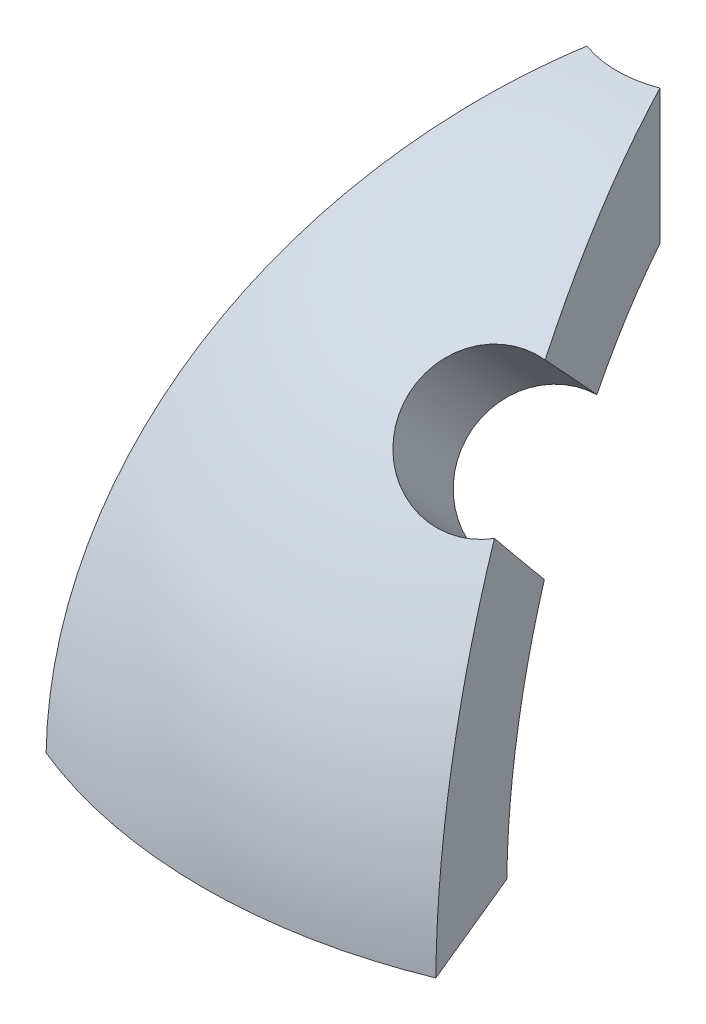
from build123d import *

# Parameters (mm, degrees)
REVOLVE1_ANGLE            = 45
CUT_EXTRUDE1_DEPTH        = 28.647117169
CUT_EXTRUDE1_DEPTH_BACK   = 28.647117169
CUT_EXTRUDE4_REACH        = 29.998
CUT_EXTRUDE4_START_RADIUS = 14.22
CUT_EXTRUDE4_END_RADIUS   = 14.22
CUT_EXTRUDE5_DEPTH        = 27.866361913
CUT_EXTRUDE5_DEPTH_BACK   = 27.866361913
SKETCH9_R                 = 2.6035


with BuildPart() as part:
    # Sketch1 → Revolve1 (revolve, symmetric)
    with BuildSketch(Plane(origin=(0, 0, 0), x_dir=(0, 0, -1), z_dir=(1, 0, 0))) as revolve1_sk:
        with BuildLine():
            Line((-14.217802221, 0.25), (-19.048359509, 0.25))
            ThreePointArc((-19.048359509, 0.25), (-14.676690222, 12.144845166), (-3.81, 18.66511184))
            Line((-3.81, 18.66511184), (-3.81, 13.700083941))
            ThreePointArc((-3.81, 13.700083941), (-11.246181696, 8.70240181), (-14.217802221, 0.25))
        make_face()
    revolve(axis=Axis((0, 0, 0), (0, 1, 0)), revolution_arc=REVOLVE1_ANGLE / 2)
    revolve(revolve1_sk.sketch, axis=Axis((0, 0, 0), (0, -1, 0)), revolution_arc=REVOLVE1_ANGLE / 2)

    # Sketch2 → Cut-Extrude1 (cut, two sides: drawn at the far end of the back side and taken through both)
    with BuildSketch(Plane(origin=(0, 0, 0), x_dir=(1, 0, 0), z_dir=(0, 1, 0)).offset(-CUT_EXTRUDE1_DEPTH_BACK)):
        with BuildLine():
            Line((7.289491598, -17.598389479), (1.458023877, -3.519981019))
            ThreePointArc((1.458023877, -3.519981019), (1.400077392, -3.543428184), (1.341754023, -3.5659215))
            Line((1.341754023, -3.5659215), (7.173849701, -17.645845983))
            ThreePointArc((7.173849701, -17.645845983), (7.231709577, -17.622212591), (7.289491598, -17.598389479))
        make_face()
        with BuildLine():
            Line((-7.173849701, -17.645845983), (-1.341754023, -3.5659215))
            ThreePointArc((-1.341754023, -3.5659215), (-1.400077392, -3.543428184), (-1.458023877, -3.519981019))
            Line((-1.458023877, -3.519981019), (-7.289491598, -17.598389479))
            ThreePointArc((-7.289491598, -17.598389479), (-7.231709577, -17.622212591), (-7.173849701, -17.645845983))
        make_face()
    extrude(amount=CUT_EXTRUDE1_DEPTH + CUT_EXTRUDE1_DEPTH_BACK, mode=Mode.SUBTRACT)

    # Cut-Extrude4: from a sphere face, 29.998 long prism both ways, kept between that surface and its translate by the depth
    cut_extrude4_start = Location((0, 0, 0)) * Sphere(CUT_EXTRUDE4_START_RADIUS, mode=Mode.PRIVATE)
    cut_extrude4_end = Location((0, 0.145802388, 0.351998102)) * Sphere(CUT_EXTRUDE4_END_RADIUS, mode=Mode.PRIVATE)
    # Sketch8 → Cut-Extrude4 (cut, from a surface)
    with BuildSketch(Plane(origin=(0, 0, 0), x_dir=(-1, 0, 0), z_dir=(0, 0.3826834323650899, 0.9238795325112868)), mode=Mode.PRIVATE) as cut_extrude4_sk1:
        Polygon((-1.253717949, -0.505052528), (1.481666667, -0.505052528), (-0.854807692, 4.053921831), (-1.199402043, 3.864261374), (0.80672476, -0.049155093), (-1.253717949, -0.049155093), align=None)
    cut_extrude4_tool1 = extrude(cut_extrude4_sk1.sketch, amount=CUT_EXTRUDE4_REACH, both=True, mode=Mode.PRIVATE)
    add(((cut_extrude4_tool1 - cut_extrude4_start) & cut_extrude4_end).solids().sort_by_distance((0, 7.838946, 9.725445))[0], mode=Mode.SUBTRACT)

    # Sketch9 → Cut-Extrude5 (cut, two sides: drawn at the far end of the back side and taken through both)
    with BuildSketch(Plane(origin=(5.827608686, 18.858537854, 17.935535314), x_dir=(-0.8206892018836905, -0.23968096505674552, 0.5186735668038023), z_dir=(-0.2185080122244017, -0.7071067811865477, -0.67249851196396)).offset(-CUT_EXTRUDE5_DEPTH_BACK)):
        Circle(SKETCH9_R)
    extrude(amount=CUT_EXTRUDE5_DEPTH + CUT_EXTRUDE5_DEPTH_BACK, mode=Mode.SUBTRACT)


solid = part.part
